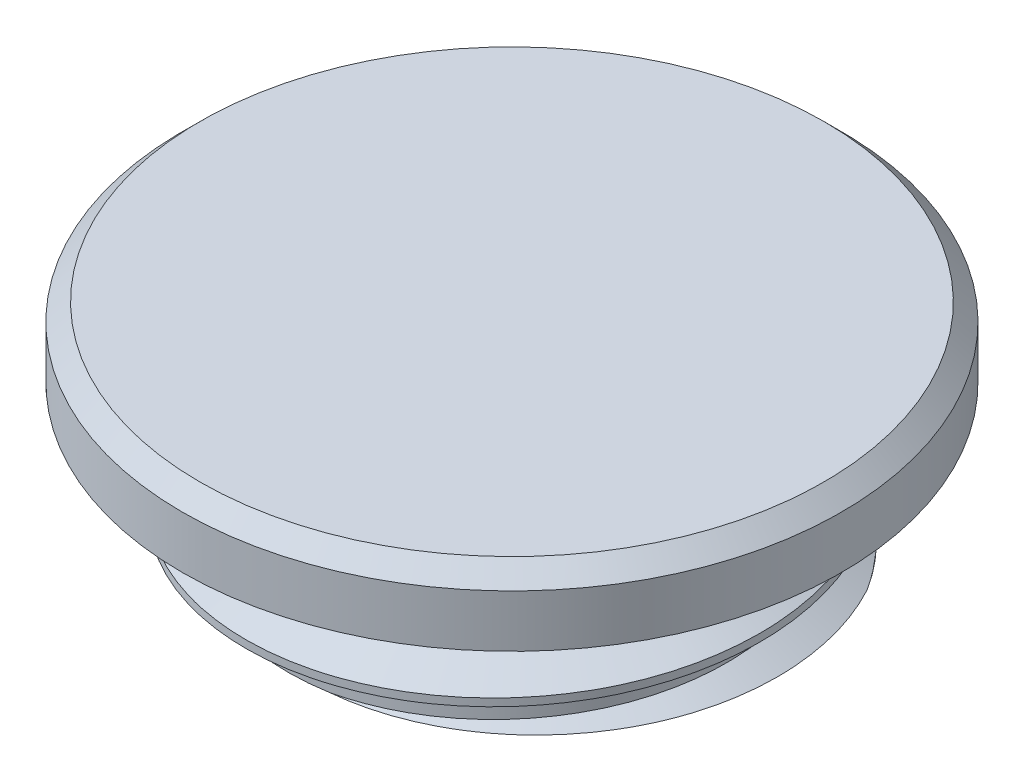
from build123d import *

# Parameters (mm, degrees)
SKETCH1_R           = 14.75
BOSS_EXTRUDE1_DEPTH = 8
SKETCH2_R           = 18.9
BOSS_EXTRUDE2_DEPTH = 4
THREAD1_PITCH       = 3.5
THREAD1_FROM        = 3.5
CHAMFER2_SIZE       = 1
SKETCH3_R           = 2
CUT_EXTRUDE1_DEPTH  = 1


with BuildPart() as part:
    # Sketch1 → Boss-Extrude1 (new body)
    with BuildSketch(Plane(origin=(0, 0, 0), x_dir=(1, 0, 0), z_dir=(0, 1, 0))):
        with Locations(Location((0, 0, 0), (0, 0, 270))):
            Circle(SKETCH1_R)
    extrude(amount=BOSS_EXTRUDE1_DEPTH)

    # Sketch2 → Boss-Extrude2 (add)
    with BuildSketch(Plane(origin=(0, 8, 0), x_dir=(1, 0, 0), z_dir=(0, 1, 0))):
        with Locations(Location((-0.005064595, -0.031492848, 0), (0, 0, 270))):
            Circle(SKETCH2_R)
    extrude(amount=BOSS_EXTRUDE2_DEPTH)

    # Thread1: arcs per turn and ends read off the stored shape
    # Thread1: the profile of Thread Profile1 profile screwed along a right-hand helix through 3.285714 turns, 12 arcs to a turn; built about Z, then put on its axis
    thread1_z = Axis((0, 0, 0), (0, 0, 1))
    thread1_corners = [(14.7503, 0, -0.000173205), (14.7503, 0, 3.062673196), (12.855569438, 0, 1.968749995), (12.855569438, 0, 1.093749995)]
    with BuildLine(mode=Mode.PRIVATE) as thread1_profile:
        Line(thread1_corners[0], thread1_corners[1])
        Line(thread1_corners[1], thread1_corners[2])
        Line(thread1_corners[2], thread1_corners[3])
        Line(thread1_corners[3], thread1_corners[0])
    thread1_cap = Face(thread1_profile.wire())
    thread1_turn_angles = [0, 15, 30, 45, 60, 75, 90, 105, 120, 135, 150, 165, 180, 195, 210, 225, 240, 255, 270, 285, 300, 315, 330, 345, 360]
    thread1_turn_weights = [1, 0.9659258262890683, 1, 0.9659258262890683, 1, 0.9659258262890683, 1, 0.9659258262890683, 1, 0.9659258262890683, 1, 0.9659258262890683, 1, 0.9659258262890683, 1, 0.9659258262890683, 1, 0.9659258262890683, 1, 0.9659258262890683, 1, 0.9659258262890683, 1, 0.9659258262890683, 1]
    thread1_turn_rails = [Edge.make_bspline([Vector(p[0], p[1], 0).rotate(thread1_z, thread1_turn_angles[k]) / thread1_turn_weights[k] + Vector(0, 0, p[2] + THREAD1_PITCH * thread1_turn_angles[k] / 360) for k in range(25)], [0, 0, 0, 1, 1, 2, 2, 3, 3, 4, 4, 5, 5, 6, 6, 7, 7, 8, 8, 9, 9, 10, 10, 11, 11, 12, 12, 12], 2, thread1_turn_weights) for p in thread1_corners]
    thread1_turn_sides = [Face.make_surface_from_curves(thread1_turn_rails[p[0]], thread1_turn_rails[p[1]]) for p in [(0, 1), (1, 2), (2, 3), (3, 0)]]
    thread1_last_angles = [1080, 1095, 1110, 1125, 1140, 1155, 1170, 1176.428571429, 1182.857142857]
    thread1_last_weights = [1, 0.9659258262890683, 1, 0.9659258262890683, 1, 0.9659258262890683, 1, 0.9937122098932428, 1]
    thread1_last_rails = [Edge.make_bspline([Vector(p[0], p[1], 0).rotate(thread1_z, thread1_last_angles[k]) / thread1_last_weights[k] + Vector(0, 0, p[2] + THREAD1_PITCH * thread1_last_angles[k] / 360) for k in range(9)], [0, 0, 0, 1, 1, 2, 2, 3, 3, 4, 4, 4], 2, thread1_last_weights) for p in thread1_corners]
    thread1_last_sides = [Face.make_surface_from_curves(thread1_last_rails[p[0]], thread1_last_rails[p[1]]) for p in [(0, 1), (1, 2), (2, 3), (3, 0)]]
    thread1 = Plane(origin=(0, 11.5, 0), x_dir=(-1, 0, 0), z_dir=(0, -1, 0)) * split(Solid(Shell([*[p.moved(Location((0, 0, THREAD1_PITCH * i))) for i in range(3) for p in thread1_turn_sides], *thread1_last_sides, thread1_cap, thread1_cap.rotate(thread1_z, 1182.857142857).moved(Location((0, 0, THREAD1_PITCH * 1182.857142857 / 360)))])), bisect_by=Plane.XY.offset(THREAD1_FROM), keep=Keep.TOP, mode=Mode.PRIVATE)
    add(thread1, mode=Mode.SUBTRACT)

    # Chamfer2
    chamfer2_edges = [part.edges().sort_by_distance(p)[0] for p in [
        (-0.005064595, 12, -18.868507152),
    ]]
    chamfer(chamfer2_edges, length=CHAMFER2_SIZE)

    # Sketch3 → Cut-Extrude1 (cut)
    with BuildSketch(Plane.XZ):
        with Locations(Location((0, 0, 0), (0, 0, 270))):
            Circle(SKETCH3_R)
    extrude(amount=-CUT_EXTRUDE1_DEPTH, mode=Mode.SUBTRACT)


solid = part.part
